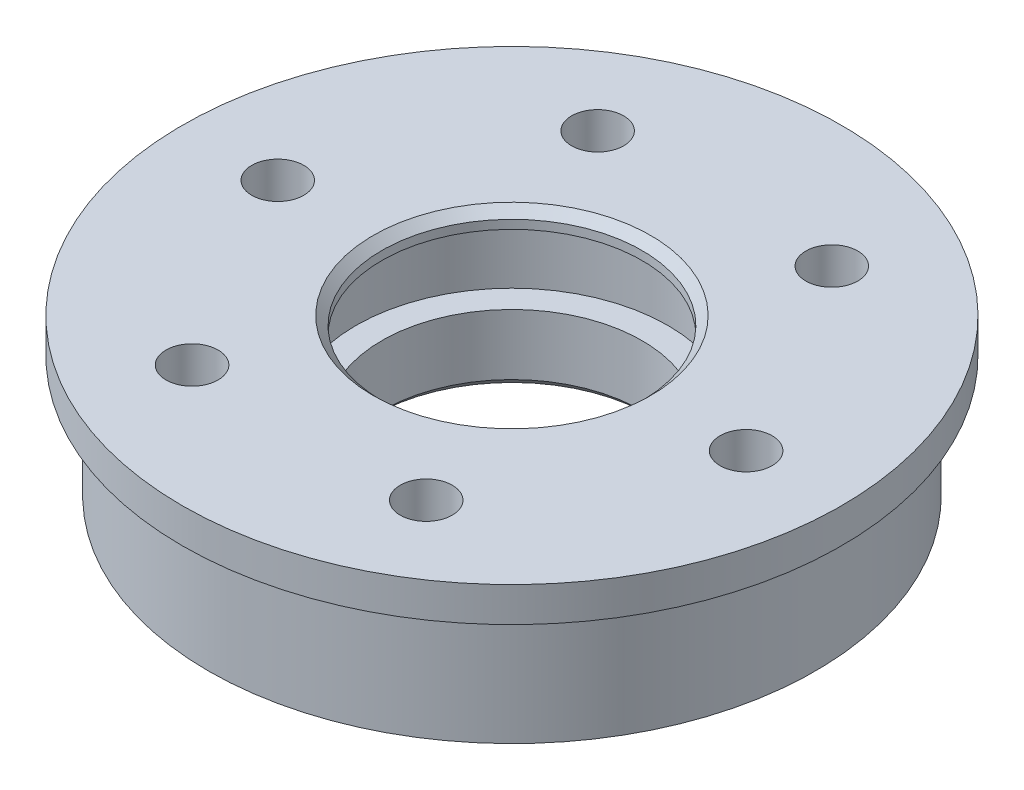
from build123d import *

# Parameters (mm, degrees)
SKETCH1_R           = 17.5
SKETCH1_R_2         = 1.5
SKETCH1_R_3         = 7.5
BOSS_EXTRUDE1_DEPTH = 4.5
CUT_EXTRUDE1_START  = -0.5
SKETCH2_R           = 9
CUT_EXTRUDE1_DEPTH  = 4
SKETCH3_R           = 15
SKETCH3_R_2         = 12
BOSS_EXTRUDE2_DEPTH = 1.5
CHAMFER1_SIZE       = 0.5
SKETCH4_R           = 19
SKETCH4_R_2         = 17.5
BOSS_EXTRUDE3_DEPTH = 2
SKETCH5_R           = 2.35
CUT_EXTRUDE2_DEPTH  = 4


with BuildPart() as part:
    # Sketch1 → Boss-Extrude1 (new, symmetric)
    with BuildSketch(Plane(origin=(0, 0, 0), x_dir=(1, 0, 0), z_dir=(0, 1, 0))):
        Circle(SKETCH1_R)
        with Locations((13.5, 0)):
            Circle(SKETCH1_R_2, mode=Mode.SUBTRACT)
        with Locations((6.75, -11.691342951)):
            Circle(SKETCH1_R_2, mode=Mode.SUBTRACT)
        with Locations((-6.75, -11.691342951)):
            Circle(SKETCH1_R_2, mode=Mode.SUBTRACT)
        with Locations((-13.5, 0)):
            Circle(SKETCH1_R_2, mode=Mode.SUBTRACT)
        with Locations((-6.75, 11.691342951)):
            Circle(SKETCH1_R_2, mode=Mode.SUBTRACT)
        with Locations((6.75, 11.691342951)):
            Circle(SKETCH1_R_2, mode=Mode.SUBTRACT)
        Circle(SKETCH1_R_3, mode=Mode.SUBTRACT)
    extrude(amount=BOSS_EXTRUDE1_DEPTH, both=True)

    # Sketch2 → Cut-Extrude1 (cut)
    with BuildSketch(Plane(origin=(0, 0, 0), x_dir=(1, 0, 0), z_dir=(0, 1, 0)).offset(CUT_EXTRUDE1_START)):
        Circle(SKETCH2_R)
    extrude(amount=CUT_EXTRUDE1_DEPTH, mode=Mode.SUBTRACT)

    # Sketch3 → Boss-Extrude2 (add)
    with BuildSketch(Plane.XZ.offset(4.5)):
        Circle(SKETCH3_R)
        Circle(SKETCH3_R_2, mode=Mode.SUBTRACT)
    extrude(amount=-BOSS_EXTRUDE2_DEPTH)

    # Chamfer1
    chamfer1_edges = [part.edges().sort_by_distance(p)[0] for p in [
        (-7.5, -4.5, 0),
        (-7.5, 4.5, 0),
    ]]
    chamfer(chamfer1_edges, length=CHAMFER1_SIZE)

    # Sketch4 → Boss-Extrude3 (add)
    with BuildSketch(Plane(origin=(0, 4.5, 0), x_dir=(1, 0, 0), z_dir=(0, 1, 0))):
        Circle(SKETCH4_R)
        Circle(SKETCH4_R_2, mode=Mode.SUBTRACT)
    extrude(amount=-BOSS_EXTRUDE3_DEPTH)

    # Sketch5 → Cut-Extrude2 (cut)
    with BuildSketch(Plane(origin=(0, -4.5, 0), x_dir=(-1, 0, 0), z_dir=(0, -1, 0))):
        with Locations((-10.825317547, -6.25)):
            Circle(SKETCH5_R)
        with Locations((-10.825317547, 6.25)):
            Circle(SKETCH5_R)
        with Locations((0, 12.5)):
            Circle(SKETCH5_R)
        with Locations((10.825317547, 6.25)):
            Circle(SKETCH5_R)
        with Locations((10.825317547, -6.25)):
            Circle(SKETCH5_R)
        with Locations((0, -12.5)):
            Circle(SKETCH5_R)
    extrude(amount=-CUT_EXTRUDE2_DEPTH, mode=Mode.SUBTRACT)


solid = part.part
